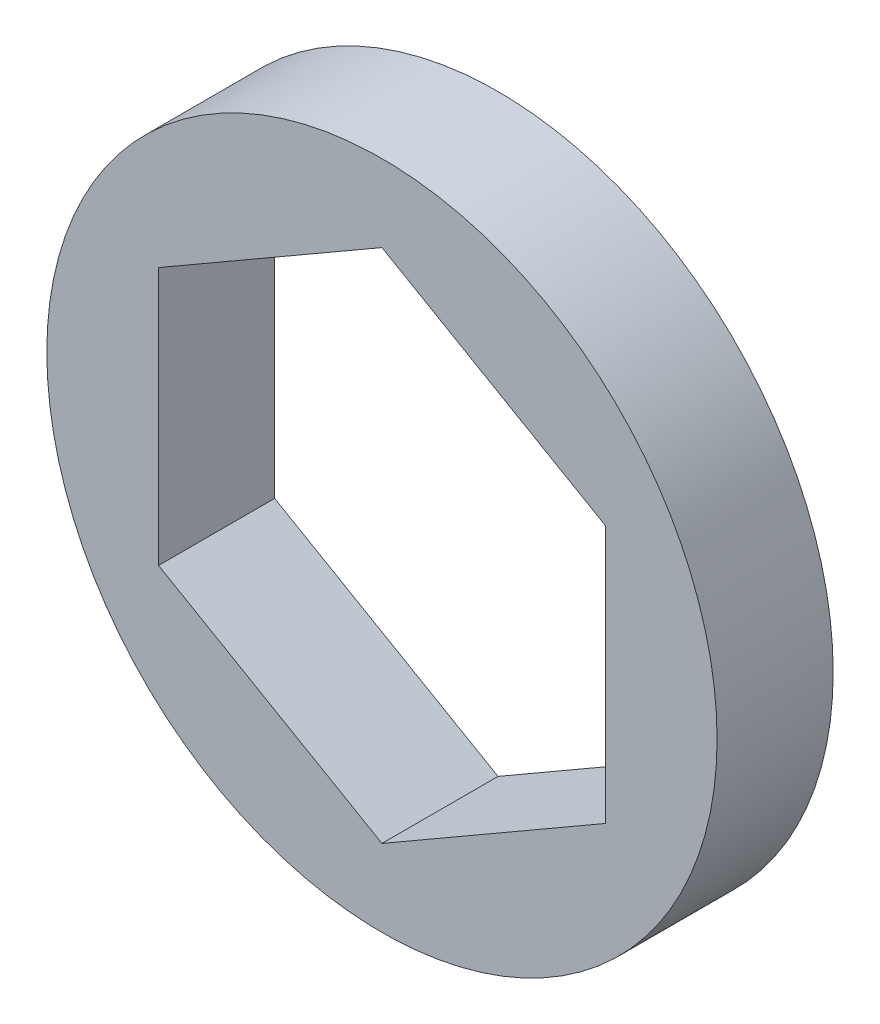
from build123d import *

# Parameters (mm, degrees)
SKETCH1_R           = 9.525
BOSS_EXTRUDE1_DEPTH = 3.29946


with BuildPart() as part:
    # Sketch1 → Boss-Extrude1 (new body)
    with BuildSketch(Plane.XY):
        Circle(SKETCH1_R)
        Polygon((0, 7.332348419), (-6.35, 3.666174209), (-6.35, -3.666174209), (0, -7.332348419), (6.35, -3.666174209), (6.35, 3.666174209), align=None, mode=Mode.SUBTRACT)
    extrude(amount=BOSS_EXTRUDE1_DEPTH)


solid = part.part
